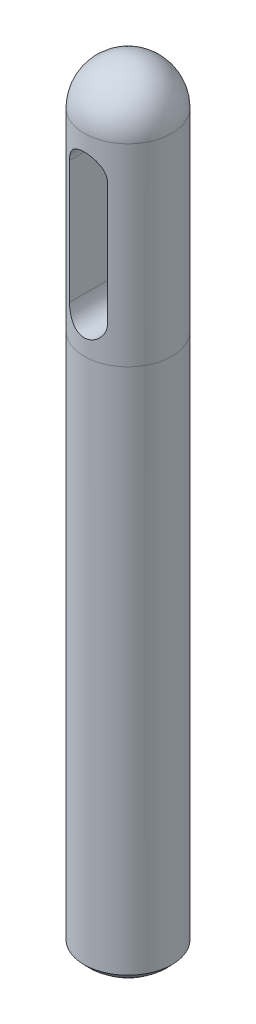
from build123d import *

# Parameters (mm, degrees)
SZKIC2_R                        = 2.5
DODANIE_WYCI_GNI_CIE1_DEPTH     = 30
WYTNIJ_WYCI_GNI_CIE1_DEPTH      = 20
WYTNIJ_WYCI_GNI_CIE1_DEPTH_BACK = 20


with BuildPart() as part:
    # Szkic2 → Dodanie-wyciągnięcie1 (new body)
    with BuildSketch(Plane(origin=(0, 0, 0), x_dir=(1, 0, 0), z_dir=(0, 1, 0))):
        Circle(SZKIC2_R)
    extrude(amount=DODANIE_WYCI_GNI_CIE1_DEPTH)

    # Szkic3 → Obrót2 (revolve)
    with BuildSketch(Plane.XY):
        with BuildLine():
            Line((-2.497718644, 41), (-2.497718644, 30))
            Line((-2.497718644, 30), (0, 30))
            Line((0, 30), (0, 43.497718644))
            ThreePointArc((0, 43.497718644), (-1.766153791, 42.766153791), (-2.497718644, 41))
        make_face()
    revolve(axis=Axis((0, 0, 0), (0, 1, 0)))

    # Szkic3<3> → Wytnij-wyciągnięcie1 (cut, two sides: drawn at the far end of the back side and taken through both)
    with BuildSketch(Plane.XY.offset(-WYTNIJ_WYCI_GNI_CIE1_DEPTH_BACK)):
        with BuildLine():
            ThreePointArc((-1.081563109, 32), (0, 30.918436891), (1.081563109, 32))
            Line((1.081563109, 32), (1.081563109, 39))
            ThreePointArc((1.081563109, 39), (0, 40.081563109), (-1.081563109, 39))
            Line((-1.081563109, 39), (-1.081563109, 32))
        make_face()
    extrude(amount=WYTNIJ_WYCI_GNI_CIE1_DEPTH + WYTNIJ_WYCI_GNI_CIE1_DEPTH_BACK, mode=Mode.SUBTRACT)

    # Szkic4 → Obrót3 (revolve)
    with BuildSketch(Plane.XY):
        with BuildLine():
            ThreePointArc((-2.5, 0), (-1.382027756, -0.869452827), (0, -1.178983829))
            Line((0, -1.178983829), (0, 0))
            Line((0, 0), (-2.5, 0))
        make_face()
    revolve(axis=Axis((0, -1.178983829, 0), (0, 1, 0)))


solid = part.part
